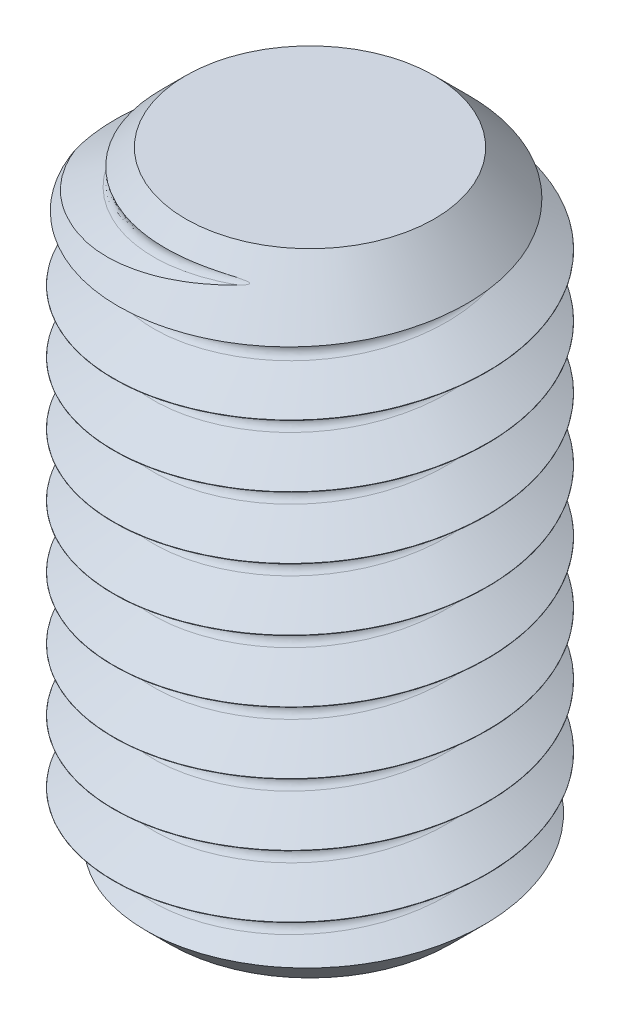
from build123d import *

# Parameters (mm, degrees)
SKETCH1_R               = 1.5
BOSS_EXTRUDE1_DEPTH     = 2.81
CUT_EXTRUDE1_DEPTH      = 1.5
CUT_SWEEP1_PITCH        = 0.5
CUT_EXTRUDE3_DEPTH      = 4.520809731
CUT_EXTRUDE3_DEPTH_BACK = 4.520809731
SKETCH7_W               = 2
SKETCH7_H               = 1.658340921


with BuildPart() as part:
    # Sketch1 → Boss-Extrude1 (new, symmetric)
    with BuildSketch(Plane(origin=(0, 0, 0), x_dir=(1, 0, 0), z_dir=(0, 1, 0))):
        with Locations(Location((0, 0, 0), (0, 0, 270))):
            Circle(SKETCH1_R)
    extrude(amount=BOSS_EXTRUDE1_DEPTH, both=True)

    # Sketch2 → Cut-Revolve1 (revolve, cut)
    with BuildSketch(Plane.XY, mode=Mode.PRIVATE) as cut_revolve1_sk:
        Polygon((0.375, 2.81), (2.587389734, 0.597610266), (2.587389734, -1.347610266), (1.125, -2.81), (1.125, -3.907075994), (2.760647944, -3.907075994), (2.760647944, 3.319220543), (0.375, 3.319220543), align=None)
    revolve(cut_revolve1_sk.sketch.rotate(Axis((0, 0, 0), (0, -1, 0)), 270), axis=Axis((0, 0, 0), (0, -1, 0)), mode=Mode.SUBTRACT)

    # Sketch3 → Cut-Extrude1 (cut)
    with BuildSketch(Plane.XZ.offset(2.81)):
        Polygon((0.775, -0.447446459), (0.775, 0.447446459), (0, 0.894892917), (-0.775, 0.447446459), (-0.775, -0.447446459), (0, -0.894892917), align=None)
    extrude(amount=-CUT_EXTRUDE1_DEPTH, mode=Mode.SUBTRACT)

    # Cut-Sweep1: the profile of Sketch5 screwed along a right-hand helix of 12 turns, 6 arcs to a turn; built about Z, then put on its axis
    cut_sweep1_z = Axis((0, 0, 0), (0, 0, 1))
    cut_sweep1_corners = [(-1.50177903, 0, 0.21875771), (-1.177857353, 0, 0.031741443), (-1.141782353, 0, -0.03074229), (-1.177857353, 0, -0.093226023), (-1.50177903, 0, -0.28024229)]
    with BuildLine(mode=Mode.PRIVATE) as cut_sweep1_profile:
        Line(cut_sweep1_corners[0], cut_sweep1_corners[1])
        Line(cut_sweep1_corners[3], cut_sweep1_corners[4])
        Line(cut_sweep1_corners[4], cut_sweep1_corners[0])
        ThreePointArc((-1.177857353, 0, 0.031741443), (-1.15144862, 0, 0.00533271), (-1.141782353, 0, -0.03074229))
        ThreePointArc((-1.141782353, 0, -0.03074229), (-1.15144862, 0, -0.06681729), (-1.177857353, 0, -0.093226023))
    cut_sweep1_cap = Face(cut_sweep1_profile.wire())
    cut_sweep1_arcs = [((-1.177857353, 0, 0.031741443), (-1.141782353, 0, 0.010913532), (-1.141782353, 0, -0.03074229), (1, 0.8660254037844393, 1)), ((-1.141782353, 0, -0.03074229), (-1.141782353, 0, -0.072398112), (-1.177857353, 0, -0.093226023), (1, 0.8660254037844393, 1))]  # start, shoulder, end, weights
    cut_sweep1_turn_angles = [0, 30, 60, 90, 120, 150, 180, 210, 240, 270, 300, 330, 360]
    cut_sweep1_turn_weights = [1, 0.8660254037844387, 1, 0.8660254037844387, 1, 0.8660254037844387, 1, 0.8660254037844387, 1, 0.8660254037844387, 1, 0.8660254037844387, 1]
    cut_sweep1_turn_rails = [Edge.make_bspline([Vector(p[0], p[1], 0).rotate(cut_sweep1_z, cut_sweep1_turn_angles[k]) / cut_sweep1_turn_weights[k] + Vector(0, 0, p[2] + CUT_SWEEP1_PITCH * cut_sweep1_turn_angles[k] / 360) for k in range(13)], [0, 0, 0, 1, 1, 2, 2, 3, 3, 4, 4, 5, 5, 6, 6, 6], 2, cut_sweep1_turn_weights) for p in cut_sweep1_corners]
    cut_sweep1_turn_sides = [*[Face.make_surface_from_curves(cut_sweep1_turn_rails[p[0]], cut_sweep1_turn_rails[p[1]]) for p in [(0, 1), (3, 4), (4, 0)]], *[Face.make_bezier_surface([[Vector(p[j][0], p[j][1], 0).rotate(cut_sweep1_z, cut_sweep1_turn_angles[2 * i + k]) / cut_sweep1_turn_weights[2 * i + k] + Vector(0, 0, p[j][2] + CUT_SWEEP1_PITCH * cut_sweep1_turn_angles[2 * i + k] / 360) for k in range(3)] for j in range(3)], [[p[3][j] * cut_sweep1_turn_weights[2 * i + k] for k in range(3)] for j in range(3)]) for p in cut_sweep1_arcs for i in range(6)]]
    cut_sweep1 = Plane(origin=(0, -2.81, 0), x_dir=(-1, 0, 0), z_dir=(0, 1, 0)) * Solid(Shell([*[p.moved(Location((0, 0, CUT_SWEEP1_PITCH * i))) for i in range(12) for p in cut_sweep1_turn_sides], cut_sweep1_cap, cut_sweep1_cap.rotate(cut_sweep1_z, 4320).moved(Location((0, 0, CUT_SWEEP1_PITCH * 4320 / 360)))]))
    add(cut_sweep1, mode=Mode.SUBTRACT)

    # Cut-Extrude2 cone 1 section (through the dimple's axis) → Cut-Extrude2 (revolve, cut)
    with BuildSketch(Plane(origin=(0, -2.81, 0), x_dir=(0, 0, -1), z_dir=(1, 0, 0))):
        Polygon((0, 0), (0.894892917, 0), (0, 0.239785834), align=None)
    revolve(axis=Axis((0, -2.81, 0), (0, 1, 0)), mode=Mode.SUBTRACT)

    # Sketch7 → Cut-Extrude3 (cut, two sides: drawn at the far end of the back side and taken through both)
    with BuildSketch(Plane.XY.offset(-CUT_EXTRUDE3_DEPTH_BACK)):
        with Locations((0, 3.01417046)):
            Rectangle(SKETCH7_W, SKETCH7_H)
    extrude(amount=CUT_EXTRUDE3_DEPTH + CUT_EXTRUDE3_DEPTH_BACK, mode=Mode.SUBTRACT)


solid = part.part
